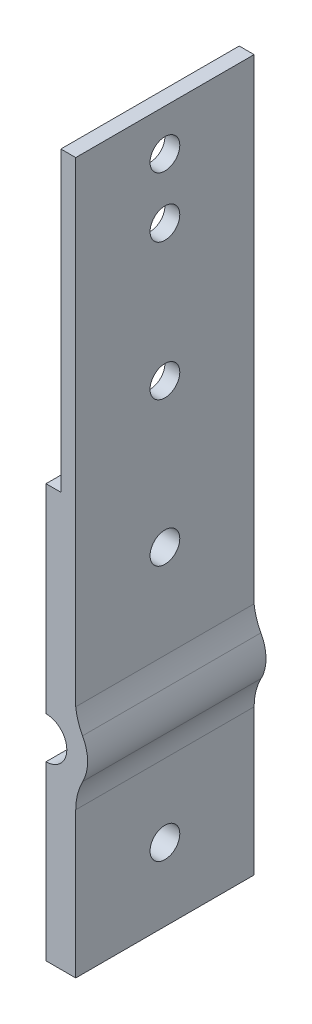
from build123d import *

# Parameters (mm, degrees)
SKETCH1_R           = 7
SKETCH1_R_2         = 2.5
BOSS_EXTRUDE1_DEPTH = 30
SKETCH2_W           = 5
SKETCH2_H           = 80
BOSS_EXTRUDE2_DEPTH = 30
SKETCH3_W           = 4.993372703
SKETCH3_H           = 5.857886356
BOSS_EXTRUDE3_DEPTH = 30
FILLET1_R           = 10
SKETCH4_R           = 2.5
CUT_EXTRUDE1_DEPTH  = 30
SKETCH5_W           = 18.483603476
SKETCH5_H           = 15.568617645
CUT_EXTRUDE2_DEPTH  = 30
SKETCH6_W           = 30
SKETCH6_H           = 30
BOSS_EXTRUDE4_DEPTH = 5
FILLET2_R           = 10
SKETCH7_R           = 2.5
CUT_EXTRUDE3_DEPTH  = 5
SKETCH8_R           = 3.5
CUT_EXTRUDE4_DEPTH  = 45
SKETCH9_W           = 2.5
SKETCH9_H           = 50
CUT_EXTRUDE5_DEPTH  = 50


with BuildPart() as part:
    # Sketch1 → Boss-Extrude1 (new body)
    with BuildSketch(Plane.XY):
        Circle(SKETCH1_R)
        Circle(SKETCH1_R_2, mode=Mode.SUBTRACT)
    extrude(amount=BOSS_EXTRUDE1_DEPTH)



with BuildPart() as body_2:
    # Sketch2 → Boss-Extrude2 (new body)
    with BuildSketch(Plane.XY.offset(30)):
        with Locations((2.5, 47)):
            Rectangle(SKETCH2_W, SKETCH2_H)
    extrude(amount=-BOSS_EXTRUDE2_DEPTH)


with BuildPart() as part_1:
    add(part.part)

    add(body_2.part)  # Boss-Extrude3 merges body 2
    # Sketch3 → Boss-Extrude3 (add)
    with BuildSketch(Plane.XY.offset(30)):
        with Locations((2.496686352, 6.222987156)):
            Rectangle(SKETCH3_W, SKETCH3_H)
    extrude(amount=-BOSS_EXTRUDE3_DEPTH)

    # Fillet1
    # the kernel refuses this fillet: 10 mm, written as the material it adds along each edge
    with BuildSketch(Plane(origin=(4.993372703, 4.905734302, 30), x_dir=(0.5953030074324868, -0.8035012939266724, 0), z_dir=(0, 0, -1))) as fillet1_piece_1:
        with BuildLine():
            CenterArc((3.322951104, -9.903685446), FILLET1_R, 97.958528589, 22.079165002)
            Line((-1.682745198, -1.246722668), (-1.782859124, -1.073583413))
            ThreePointArc((-1.782859124, -1.073583413), (-0.9604332, -0.462661075), (-0.119060601, 0.160700259))
            Line((-0.119060601, 0.160700259), (0.027691259, 0.198073709))
            ThreePointArc((0.027691259, 0.198073709), (0.969194072, 0.132579812), (1.910696885, 0.198073709))
            Line((1.910696885, 0.198073709), (1.938388144, 0))
        make_face()
    extrude(amount=30)

    # Sketch4 → Cut-Extrude1 (cut)
    with BuildSketch(Plane(origin=(5, 0, 0), x_dir=(0, 0, -1), z_dir=(1, 0, 0))):
        with Locations((-15, 22.761745694)):
            Circle(SKETCH4_R)
        with Locations((-15, 47)):
            Circle(SKETCH4_R)
        with Locations((-15, 69.953924783)):
            Circle(SKETCH4_R)
        with Locations((-15, 80.047807532)):
            Circle(SKETCH4_R)
    extrude(amount=-CUT_EXTRUDE1_DEPTH, mode=Mode.SUBTRACT)

    # Sketch5 → Cut-Extrude2 (cut)
    with BuildSketch(Plane(origin=(0, 0, 0), x_dir=(-1, 0, 0), z_dir=(0, 0, -1))):
        with Locations((9.241801738, -0.784308822)):
            Rectangle(SKETCH5_W, SKETCH5_H)
    extrude(amount=-CUT_EXTRUDE2_DEPTH, mode=Mode.SUBTRACT)

    # Sketch6 → Boss-Extrude4 (add)
    with BuildSketch(Plane.ZY):
        with Locations((15, -17.5)):
            Rectangle(SKETCH6_W, SKETCH6_H)
    extrude(amount=-BOSS_EXTRUDE4_DEPTH)

    # Fillet2
    fillet2_edges = [part_1.edges().sort_by_distance(p)[0] for p in [
        (5, -4.898979486, 15),
    ]]
    fillet(fillet2_edges, radius=FILLET2_R)

    # Sketch7 → Cut-Extrude3 (cut)
    with BuildSketch(Plane(origin=(5, 0, 0), x_dir=(0, 0, -1), z_dir=(1, 0, 0))):
        with Locations((-15, -20.25)):
            Circle(SKETCH7_R)
    extrude(amount=-CUT_EXTRUDE3_DEPTH, mode=Mode.SUBTRACT)

    # Sketch8 → Cut-Extrude4 (cut)
    with BuildSketch(Plane(origin=(0, 0, 0), x_dir=(-1, 0, 0), z_dir=(0, 0, -1))):
        Circle(SKETCH8_R)
    extrude(amount=-CUT_EXTRUDE4_DEPTH, mode=Mode.SUBTRACT)

    # Sketch9 → Cut-Extrude5 (cut)
    with BuildSketch(Plane(origin=(0, 0, 0), x_dir=(-1, 0, 0), z_dir=(0, 0, -1))):
        with Locations((-1.25, 62)):
            Rectangle(SKETCH9_W, SKETCH9_H)
    extrude(amount=-CUT_EXTRUDE5_DEPTH, mode=Mode.SUBTRACT)


solid = part_1.part
